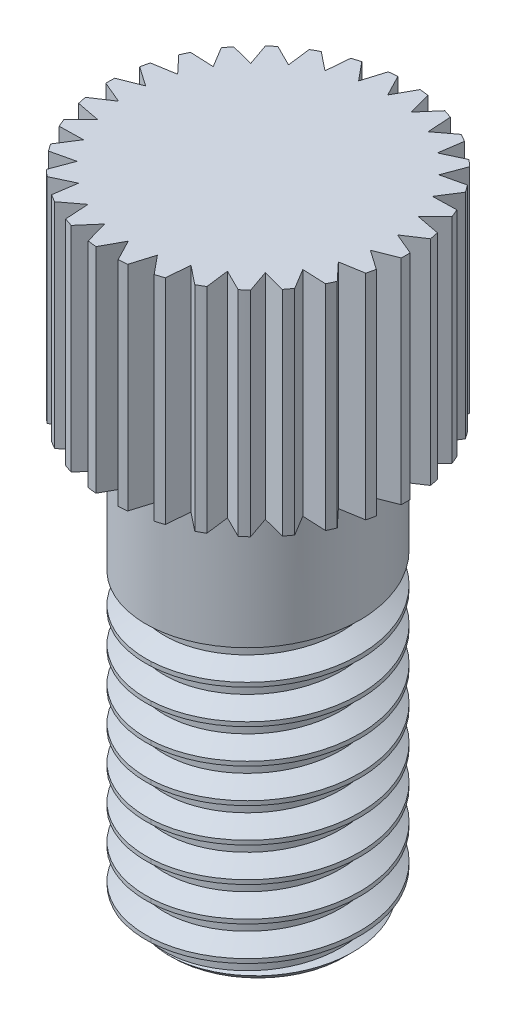
from build123d import *

# Parameters (mm, degrees)
Y_KSEKLIK_EKSTR_ZYON2_DEPTH = 5
IZIM2_R                     = 2.5
Y_KSEKLIK_EKSTR_ZYON3_DEPTH = 10
PAH1_SIZE                   = 0.5
KES_S_P_R2_PITCH            = 0.8


with BuildPart() as part:
    # Çizim1 → Yükseklik-Ekstrüzyon2 (new body)
    with BuildSketch(Plane(origin=(0, 0, 0), x_dir=(1, 0, 0), z_dir=(0, 1, 0))):
        with BuildLine():
            Line((-1.733839671, 2.448223845), (-2.231443698, 2.696415959))
            ThreePointArc((-2.231443698, 2.696415959), (-2.310292357, 2.629172726), (-2.387115737, 2.559624671))
            Line((-2.387115737, 2.559624671), (-2.204965473, 2.034238742))
            Line((-2.204965473, 2.034238742), (-2.7432977, 2.173549569))
            ThreePointArc((-2.7432977, 2.173549569), (-2.806442673, 2.091382203), (-2.867127424, 2.007381462))
            Line((-2.867127424, 2.007381462), (-2.579723704, 1.531347645))
            Line((-2.579723704, 1.531347645), (-3.135256429, 1.555688633))
            ThreePointArc((-3.135256429, 1.555688633), (-3.179937978, 1.462188243), (-3.221831885, 1.36740605))
            Line((-3.221831885, 1.36740605), (-2.84173563, 0.961529308))
            Line((-2.84173563, 0.961529308), (-3.390189408, 0.869836638))
            ThreePointArc((-3.390189408, 0.869836638), (-3.414454733, 0.76908964), (-3.435726832, 0.667668432))
            Line((-3.435726832, 0.667668432), (-2.979550072, 0.349687526))
            Line((-2.979550072, 0.349687526), (-3.496954842, 0.145968609))
            ThreePointArc((-3.496954842, 0.145968609), (-3.499743433, 0.04237813), (-3.49946403, -0.0612495))
            Line((-3.49946403, -0.0612495), (-2.987143879, -0.277437279))
            Line((-2.987143879, -0.277437279), (-3.450886569, -0.58427895))
            ThreePointArc((-3.450886569, -0.58427895), (-3.43207655, -0.686185509), (-3.410257858, -0.787490535))
            Line((-3.410257858, -0.787490535), (-2.864185165, -0.892436743))
            Line((-2.864185165, -0.892436743), (-3.253997993, -1.288990714))
            ThreePointArc((-3.253997993, -1.288990714), (-3.214411454, -1.384759548), (-3.172007053, -1.479314454))
            Line((-3.172007053, -1.479314454), (-2.616047815, -1.46843244))
            Line((-2.616047815, -1.46843244), (-2.914894091, -1.937367399))
            ThreePointArc((-2.914894091, -1.937367399), (-2.856261152, -2.02281295), (-2.795124319, -2.106485234))
            Line((-2.795124319, -2.106485234), (-2.253576622, -1.980250592))
            Line((-2.253576622, -1.980250592), (-2.44839533, -2.501071832))
            ThreePointArc((-2.44839533, -2.501071832), (-2.373278533, -2.572459719), (-2.29608124, -2.641592501))
            Line((-2.29608124, -2.641592501), (-1.792613317, -2.405522291))
            Line((-1.792613317, -2.405522291), (-1.874889944, -2.955467425))
            ThreePointArc((-1.874889944, -2.955467425), (-1.786572253, -3.009677655), (-1.696688392, -3.0612495))
            Line((-1.696688392, -3.0612495), (-1.253304208, -2.725661124))
            Line((-1.253304208, -2.725661124), (-1.219442871, -3.280694909))
            ThreePointArc((-1.219442871, -3.280694909), (-1.121784193, -3.315358235), (-1.023142121, -3.347115206))
            Line((-1.023142121, -3.347115206), (-0.659219692, -2.926675486))
            Line((-0.659219692, -2.926675486), (-0.510700293, -3.462540283))
            ThreePointArc((-0.510700293, -3.462540283), (-0.407968781, -3.476141751), (-0.304879629, -3.486695916))
            Line((-0.304879629, -3.486695916), (-0.036324111, -2.999780085))
            Line((-0.036324111, -2.999780085), (0.220362338, -3.493056032))
            ThreePointArc((0.220362338, -3.493056032), (0.323676825, -3.485001193), (0.426707566, -3.473891284))
            Line((0.426707566, -3.473891284), (0.588159008, -2.9417799))
            Line((0.588159008, -2.9417799), (0.941794078, -3.37090847))
            ThreePointArc((0.941794078, -3.37090847), (1.0411762, -3.341549359), (1.139645592, -3.309260933))
            Line((1.139645592, -3.309260933), (1.186936755, -2.755209818))
            Line((1.186936755, -2.755209818), (1.622064898, -3.101436033))
            ThreePointArc((1.622064898, -3.101436033), (1.71317118, -3.052055784), (1.802775638, -3))
            Line((1.802775638, -3), (1.733839671, -2.448223845))
            Line((1.733839671, -2.448223845), (2.231443698, -2.696415959))
            ThreePointArc((2.231443698, -2.696415959), (2.310292357, -2.629172726), (2.387115737, -2.559624671))
            Line((2.387115737, -2.559624671), (2.204965473, -2.034238742))
            Line((2.204965473, -2.034238742), (2.7432977, -2.173549569))
            ThreePointArc((2.7432977, -2.173549569), (2.806442673, -2.091382203), (2.867127424, -2.007381462))
            Line((2.867127424, -2.007381462), (2.579723704, -1.531347645))
            Line((2.579723704, -1.531347645), (3.135256429, -1.555688633))
            ThreePointArc((3.135256429, -1.555688633), (3.179937978, -1.462188243), (3.221831885, -1.36740605))
            Line((3.221831885, -1.36740605), (2.84173563, -0.961529308))
            Line((2.84173563, -0.961529308), (3.390189408, -0.869836638))
            ThreePointArc((3.390189408, -0.869836638), (3.414454733, -0.76908964), (3.435726832, -0.667668432))
            Line((3.435726832, -0.667668432), (2.979550072, -0.349687526))
            Line((2.979550072, -0.349687526), (3.496954842, -0.145968609))
            ThreePointArc((3.496954842, -0.145968609), (3.499238628, -0.073000184), (3.5, 0))
            ThreePointArc((3.5, 0), (3.499866005, 0.030625922), (3.49946403, 0.0612495))
            Line((3.49946403, 0.0612495), (2.987143879, 0.277437279))
            Line((2.987143879, 0.277437279), (3.450886569, 0.58427895))
            ThreePointArc((3.450886569, 0.58427895), (3.43207655, 0.686185509), (3.410257858, 0.787490535))
            Line((3.410257858, 0.787490535), (2.864185165, 0.892436743))
            Line((2.864185165, 0.892436743), (3.253997993, 1.288990714))
            ThreePointArc((3.253997993, 1.288990714), (3.214411454, 1.384759548), (3.172007053, 1.479314454))
            Line((3.172007053, 1.479314454), (2.616047815, 1.46843244))
            Line((2.616047815, 1.46843244), (2.914894091, 1.937367399))
            ThreePointArc((2.914894091, 1.937367399), (2.856261152, 2.02281295), (2.795124319, 2.106485234))
            Line((2.795124319, 2.106485234), (2.253576622, 1.980250592))
            Line((2.253576622, 1.980250592), (2.44839533, 2.501071832))
            ThreePointArc((2.44839533, 2.501071832), (2.373278533, 2.572459719), (2.29608124, 2.641592501))
            Line((2.29608124, 2.641592501), (1.792613317, 2.405522291))
            Line((1.792613317, 2.405522291), (1.874889944, 2.955467425))
            ThreePointArc((1.874889944, 2.955467425), (1.786572253, 3.009677655), (1.696688392, 3.0612495))
            Line((1.696688392, 3.0612495), (1.253304208, 2.725661124))
            Line((1.253304208, 2.725661124), (1.219442871, 3.280694909))
            ThreePointArc((1.219442871, 3.280694909), (1.121784193, 3.315358235), (1.023142121, 3.347115206))
            Line((1.023142121, 3.347115206), (0.659219692, 2.926675486))
            Line((0.659219692, 2.926675486), (0.510700293, 3.462540283))
            ThreePointArc((0.510700293, 3.462540283), (0.407968781, 3.476141751), (0.304879629, 3.486695916))
            Line((0.304879629, 3.486695916), (0.036324111, 2.999780085))
            Line((0.036324111, 2.999780085), (-0.220362338, 3.493056032))
            ThreePointArc((-0.220362338, 3.493056032), (-0.323676825, 3.485001193), (-0.426707566, 3.473891284))
            Line((-0.426707566, 3.473891284), (-0.588159008, 2.9417799))
            Line((-0.588159008, 2.9417799), (-0.941794078, 3.37090847))
            ThreePointArc((-0.941794078, 3.37090847), (-1.0411762, 3.341549359), (-1.139645592, 3.309260933))
            Line((-1.139645592, 3.309260933), (-1.186936755, 2.755209818))
            Line((-1.186936755, 2.755209818), (-1.622064898, 3.101436033))
            ThreePointArc((-1.622064898, 3.101436033), (-1.71317118, 3.052055784), (-1.802775638, 3))
            Line((-1.802775638, 3), (-1.733839671, 2.448223845))
        make_face()
    extrude(amount=Y_KSEKLIK_EKSTR_ZYON2_DEPTH)

    # Çizim2 → Yükseklik-Ekstrüzyon3 (add)
    with BuildSketch(Plane.XZ):
        with Locations(Location((0, 0, 0), (0, 0, 90))):
            Circle(IZIM2_R)
    extrude(amount=Y_KSEKLIK_EKSTR_ZYON3_DEPTH)

    # Pah1
    pah1_edges = [part.edges().sort_by_distance(p)[0] for p in [
        (0, -10, -2.5),
    ]]
    chamfer(pah1_edges, length=PAH1_SIZE)

    # Kes-Süpür2: the profile of Çizim9 profile screwed along a right-hand helix of 8.75 turns, 8 arcs to a turn; built about Z, then put on its axis
    kes_s_p_r2_z = Axis((0, 0, 0), (0, 0, 1))
    kes_s_p_r2_corners = [(2.067, -0.005086366, 0.099870561), (2.067, 0.005086366, -0.099870561), (2.50029996, 0.017810716, -0.349712596), (2.50029996, -0.017810716, 0.349712596)]
    with BuildLine(mode=Mode.PRIVATE) as kes_s_p_r2_profile:
        Line(kes_s_p_r2_corners[0], kes_s_p_r2_corners[1])
        Line(kes_s_p_r2_corners[1], kes_s_p_r2_corners[2])
        Line(kes_s_p_r2_corners[2], kes_s_p_r2_corners[3])
        Line(kes_s_p_r2_corners[3], kes_s_p_r2_corners[0])
    kes_s_p_r2_cap = Face(kes_s_p_r2_profile.wire())
    kes_s_p_r2_turn_angles = [0, 22.5, 45, 67.5, 90, 112.5, 135, 157.5, 180, 202.5, 225, 247.5, 270, 292.5, 315, 337.5, 360]
    kes_s_p_r2_turn_weights = [1, 0.9238795325112867, 1, 0.9238795325112867, 1, 0.9238795325112867, 1, 0.9238795325112867, 1, 0.9238795325112867, 1, 0.9238795325112867, 1, 0.9238795325112867, 1, 0.9238795325112867, 1]
    kes_s_p_r2_turn_rails = [Edge.make_bspline([Vector(p[0], p[1], 0).rotate(kes_s_p_r2_z, kes_s_p_r2_turn_angles[k]) / kes_s_p_r2_turn_weights[k] + Vector(0, 0, p[2] + KES_S_P_R2_PITCH * kes_s_p_r2_turn_angles[k] / 360) for k in range(17)], [0, 0, 0, 1, 1, 2, 2, 3, 3, 4, 4, 5, 5, 6, 6, 7, 7, 8, 8, 8], 2, kes_s_p_r2_turn_weights) for p in kes_s_p_r2_corners]
    kes_s_p_r2_turn_sides = [Face.make_surface_from_curves(kes_s_p_r2_turn_rails[p[0]], kes_s_p_r2_turn_rails[p[1]]) for p in [(0, 1), (1, 2), (2, 3), (3, 0)]]
    kes_s_p_r2_last_angles = [2880, 2902.5, 2925, 2947.5, 2970, 2992.5, 3015, 3037.5, 3060, 3082.5, 3105, 3127.5, 3150]
    kes_s_p_r2_last_weights = [1, 0.9238795325112867, 1, 0.9238795325112867, 1, 0.9238795325112867, 1, 0.9238795325112867, 1, 0.9238795325112867, 1, 0.9238795325112746, 1]
    kes_s_p_r2_last_rails = [Edge.make_bspline([Vector(p[0], p[1], 0).rotate(kes_s_p_r2_z, kes_s_p_r2_last_angles[k]) / kes_s_p_r2_last_weights[k] + Vector(0, 0, p[2] + KES_S_P_R2_PITCH * kes_s_p_r2_last_angles[k] / 360) for k in range(13)], [0, 0, 0, 1, 1, 2, 2, 3, 3, 4, 4, 5, 5, 6, 6, 6], 2, kes_s_p_r2_last_weights) for p in kes_s_p_r2_corners]
    kes_s_p_r2_last_sides = [Face.make_surface_from_curves(kes_s_p_r2_last_rails[p[0]], kes_s_p_r2_last_rails[p[1]]) for p in [(0, 1), (1, 2), (2, 3), (3, 0)]]
    kes_s_p_r2 = Plane(origin=(0, -10, 0), x_dir=(-1, 0, 0), z_dir=(0, 1, 0)) * Solid(Shell([*[p.moved(Location((0, 0, KES_S_P_R2_PITCH * i))) for i in range(8) for p in kes_s_p_r2_turn_sides], *kes_s_p_r2_last_sides, kes_s_p_r2_cap, kes_s_p_r2_cap.rotate(kes_s_p_r2_z, 3150).moved(Location((0, 0, KES_S_P_R2_PITCH * 3150 / 360)))]))
    add(kes_s_p_r2, mode=Mode.SUBTRACT)


solid = part.part
